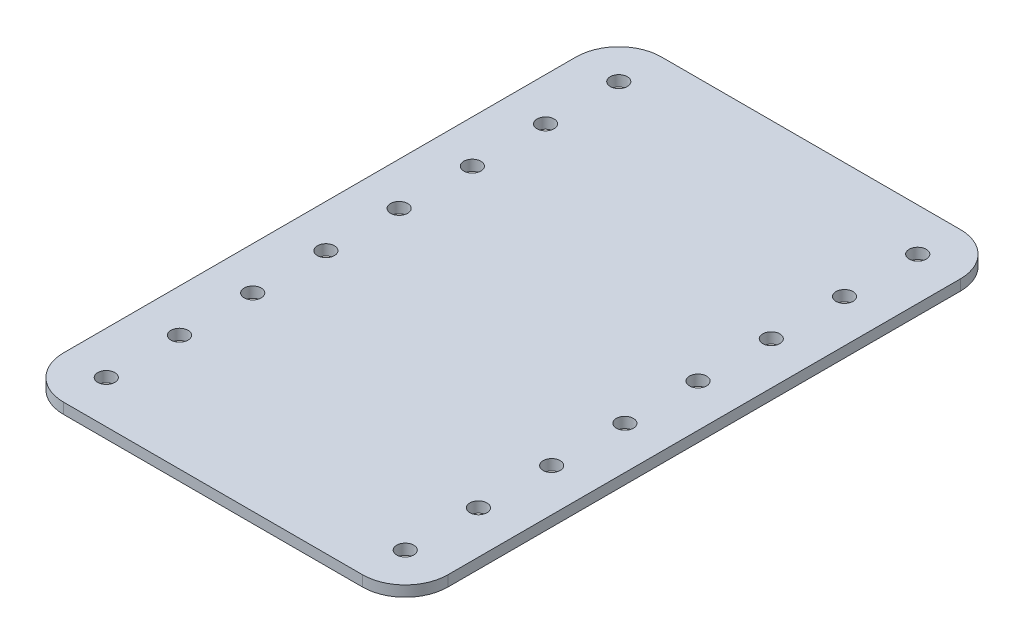
from build123d import *

# Parameters (mm, degrees)
SKETCH1_W           = 114.3
SKETCH1_H           = 177.8
BOSS_EXTRUDE1_DEPTH = 3.175
SKETCH2_R           = 2.54
CUT_EXTRUDE1_DEPTH  = 3.175
FILLET1_R           = 12.7


with BuildPart() as part:
    # Sketch1 → Boss-Extrude1 (new body)
    with BuildSketch(Plane(origin=(0, 0, 0), x_dir=(1, 0, 0), z_dir=(0, 1, 0))):
        Rectangle(SKETCH1_W, SKETCH1_H)
    extrude(amount=BOSS_EXTRUDE1_DEPTH)

    # Sketch2 → Cut-Extrude1 (cut)
    with BuildSketch(Plane(origin=(0, 3.175, 0), x_dir=(1, 0, 0), z_dir=(0, 1, 0))):
        with Locations((-44.45, 76.2)):
            Circle(SKETCH2_R)
        with Locations((-44.45, 54.428571429)):
            Circle(SKETCH2_R)
        with Locations((-44.45, 32.657142857)):
            Circle(SKETCH2_R)
        with Locations((-44.45, 10.885714286)):
            Circle(SKETCH2_R)
        with Locations((-44.45, -10.885714286)):
            Circle(SKETCH2_R)
        with Locations((-44.45, -32.657142857)):
            Circle(SKETCH2_R)
        with Locations((-44.45, -54.428571429)):
            Circle(SKETCH2_R)
        with Locations((-44.45, -76.2)):
            Circle(SKETCH2_R)
        with Locations((44.45, -76.2)):
            Circle(SKETCH2_R)
        with Locations((44.45, -54.428571429)):
            Circle(SKETCH2_R)
        with Locations((44.45, -32.657142857)):
            Circle(SKETCH2_R)
        with Locations((44.45, -10.885714286)):
            Circle(SKETCH2_R)
        with Locations((44.45, 10.885714286)):
            Circle(SKETCH2_R)
        with Locations((44.45, 32.657142857)):
            Circle(SKETCH2_R)
        with Locations((44.45, 54.428571429)):
            Circle(SKETCH2_R)
        with Locations((44.45, 76.2)):
            Circle(SKETCH2_R)
    extrude(amount=-CUT_EXTRUDE1_DEPTH, mode=Mode.SUBTRACT)

    # Fillet1
    fillet1_edges = [part.edges().sort_by_distance(p)[0] for p in [
        (-57.15, 1.5875, -88.9),
        (57.15, 1.5875, -88.9),
        (57.15, 1.5875, 88.9),
        (-57.15, 1.5875, 88.9),
    ]]
    fillet(fillet1_edges, radius=FILLET1_R)


solid = part.part
